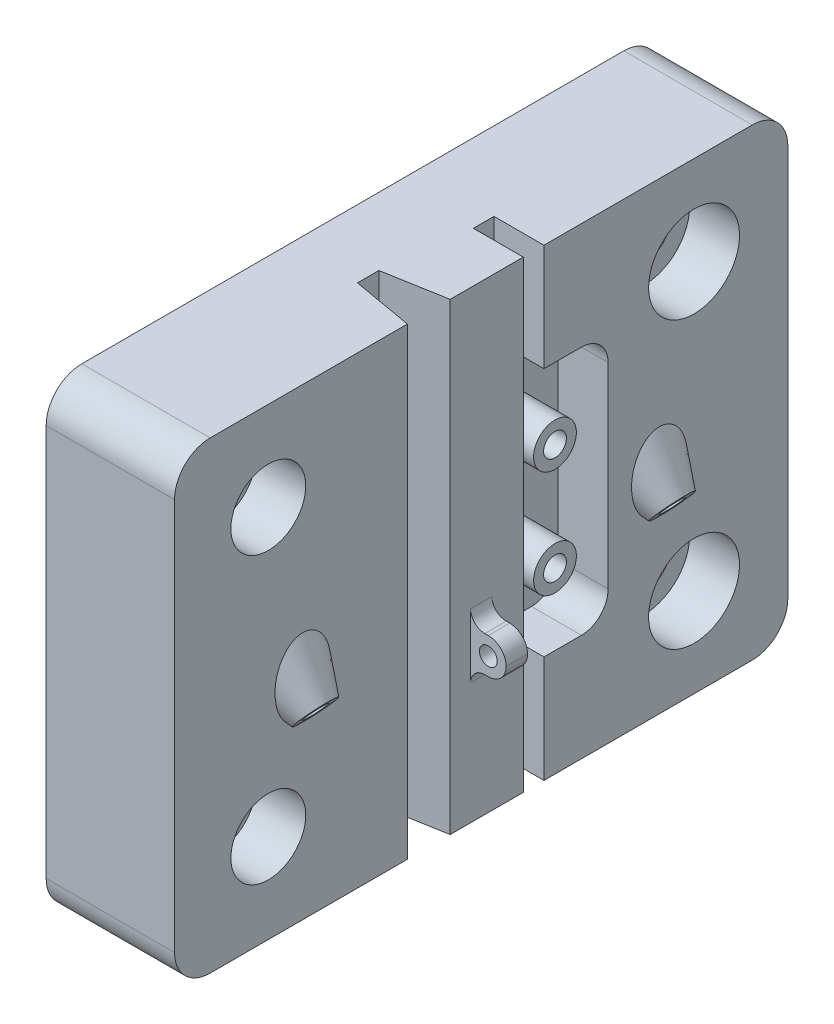
from build123d import *

# Parameters (mm, degrees)
BOSS_EXTRUDE1_DEPTH = 11
CLEAR_HOLE_BOLT_R   = 3.7
CLEAR_HOLE_BOLT_R_2 = 2.6
CUT_EXTRUDE1_DEPTH  = 56.011362463
SKETCH5_R           = 3
SKETCH5_W           = 5
SKETCH5_H           = 15
BOSS_EXTRUDE2_DEPTH = 7
M3_SUPPORT_HOLES_R  = 1.6
CUT_EXTRUDE2_DEPTH  = 57.826490302
CUT_EXTRUDE4_DEPTH  = 3
SKETCH7_R           = 5.25
SKETCH7_R_2         = 6.375
BOSS_EXTRUDE3_DEPTH = 7
CUT_EXTRUDE5_START  = -32.5
CUT_EXTRUDE5_DEPTH  = 65
SKETCH24_R          = 1.6
CUT_EXTRUDE7_DEPTH  = 64.877232071
CUT_EXTRUDE8_START  = -15.5
CUT_EXTRUDE8_DEPTH  = 20
SKETCH26_W          = 3
SKETCH26_H          = 5
BOSS_EXTRUDE7_DEPTH = 5
SKETCH27_R          = 1.25
CUT_EXTRUDE9_DEPTH  = 3
FILLET1_R           = 2.5
FILLET2_R           = 2


# Read off the part's stored shape, not the designer's step: Cut-Extrude5, Boss-Extrude6
with BuildPart() as part:
    # Main Body → Boss-Extrude1 (new body)
    with BuildSketch(Plane(origin=(0, 0, 0), x_dir=(0, 0, -1), z_dir=(1, 0, 0))):
        with BuildLine():
            Line((-38, 32.5), (38, 32.5))
            ThreePointArc((38, 32.5), (41.535533906, 31.035533906), (43, 27.5))
            Line((43, 27.5), (43, -27.5))
            ThreePointArc((43, -27.5), (41.535533906, -31.035533906), (38, -32.5))
            Line((38, -32.5), (-38, -32.5))
            ThreePointArc((-38, -32.5), (-41.535533906, -31.035533906), (-43, -27.5))
            Line((-43, -27.5), (-43, 27.5))
            ThreePointArc((-43, 27.5), (-41.535533906, 31.035533906), (-38, 32.5))
        make_face()
    extrude(amount=BOSS_EXTRUDE1_DEPTH)

    # Clear Hole-Bolt → Cut-Extrude1 (cut, through all)
    with BuildSketch(Plane(origin=(11, 0, 0), x_dir=(0, 0, -1), z_dir=(1, 0, 0))):
        with Locations((29.85, 20)):
            Circle(CLEAR_HOLE_BOLT_R)
        with Locations((-29.85, 20)):
            Circle(CLEAR_HOLE_BOLT_R_2)
        with Locations(Location((-29.85, -20, 0), (0, 0, 180))):
            Circle(CLEAR_HOLE_BOLT_R_2)
        with Locations(Location((29.85, -20, 0), (0, 0, 180))):
            Circle(CLEAR_HOLE_BOLT_R)
    extrude(amount=-CUT_EXTRUDE1_DEPTH, mode=Mode.SUBTRACT)

    # Sketch5 → Boss-Extrude2 (add)
    with BuildSketch(Plane(origin=(11, 0, 0), x_dir=(0, 0, -1), z_dir=(1, 0, 0))):
        with Locations((10.35, -7.5)):
            Circle(SKETCH5_R)
        with Locations(Location((10.35, 7.5, 0), (0, 0, 180))):
            Circle(SKETCH5_R)
        with Locations((11.3, -25)):
            Rectangle(SKETCH5_W, SKETCH5_H)
        with Locations((3.4, -25)):
            Rectangle(SKETCH5_W, SKETCH5_H)
        with Locations((11.3, 25)):
            Rectangle(SKETCH5_W, SKETCH5_H)
        with Locations((3.4, 25)):
            Rectangle(SKETCH5_W, SKETCH5_H)
    extrude(amount=BOSS_EXTRUDE2_DEPTH)

    # M3 Support Holes → Cut-Extrude2 (cut, through all)
    with BuildSketch(Plane(origin=(18, 0, 0), x_dir=(0, 0, -1), z_dir=(1, 0, 0))):
        with Locations((10.35, 7.5)):
            Circle(M3_SUPPORT_HOLES_R)
        with Locations(Location((10.35, -7.5, 0), (0, 0, 180))):
            Circle(M3_SUPPORT_HOLES_R)
    extrude(amount=-CUT_EXTRUDE2_DEPTH, mode=Mode.SUBTRACT)

    # M3 Nut Support → Cut-Extrude4 (cut)
    with BuildSketch(Plane.ZY):
        Polygon((-8.617949192, 10.5), (-12.082050808, 10.5), (-13.814101615, 7.5), (-12.082050808, 4.5), (-8.617949192, 4.5), (-6.885898385, 7.5), align=None)
        Polygon((-6.885898385, -7.5), (-8.617949192, -10.5), (-12.082050808, -10.5), (-13.814101615, -7.5), (-12.082050808, -4.5), (-8.617949192, -4.5), align=None)
    extrude(amount=-CUT_EXTRUDE4_DEPTH, mode=Mode.SUBTRACT)

    # Sketch7 → Boss-Extrude3 (add)
    # profile 1 of 2: a face of its own
    with BuildSketch(Plane(origin=(11, 0, 0), x_dir=(0, 0, -1), z_dir=(1, 0, 0))):
        with BuildLine():
            Line((5.9, 32.5), (5.9, -32.5))
            Line((5.9, -32.5), (-38, -32.5))
            ThreePointArc((-38, -32.5), (-41.535533906, -31.035533906), (-43, -27.5))
            Line((-43, -27.5), (-43, 27.5))
            ThreePointArc((-43, 27.5), (-41.535533906, 31.035533906), (-38, 32.5))
            Line((-38, 32.5), (5.9, 32.5))
        make_face()
        with Locations((-29.85, -20)):
            Circle(SKETCH7_R, mode=Mode.SUBTRACT)
        with Locations(Location((-29.85, 20, 0), (0, 0, 180))):
            Circle(SKETCH7_R, mode=Mode.SUBTRACT)
    # profile 2 of 2: a face of its own
    with BuildSketch(Plane(origin=(11, 0, 0), x_dir=(0, 0, -1), z_dir=(1, 0, 0))):
        with BuildLine():
            Line((13.8, 32.5), (13.8, 17.5))
            Line((13.8, 17.5), (14.05, 17.5))
            ThreePointArc((14.05, 17.5), (16.701650429, 16.401650429), (17.8, 13.75))
            Line((17.8, 13.75), (17.8, -13.75))
            ThreePointArc((17.8, -13.75), (16.701650429, -16.401650429), (14.05, -17.5))
            Line((14.05, -17.5), (13.8, -17.5))
            Line((13.8, -17.5), (13.8, -32.5))
            Line((13.8, -32.5), (38, -32.5))
            ThreePointArc((38, -32.5), (41.535533906, -31.035533906), (43, -27.5))
            Line((43, -27.5), (43, 27.5))
            ThreePointArc((43, 27.5), (41.535533906, 31.035533906), (38, 32.5))
            Line((38, 32.5), (13.8, 32.5))
        make_face()
        with Locations((29.85, -20)):
            Circle(SKETCH7_R_2, mode=Mode.SUBTRACT)
        with Locations(Location((29.85, 20, 0), (0, 0, 180))):
            Circle(SKETCH7_R_2, mode=Mode.SUBTRACT)
    extrude(amount=BOSS_EXTRUDE3_DEPTH)

    # Cut-Extrude5 outline → Cut-Extrude5 (cut)
    with BuildSketch(Plane(origin=(0, 0, 0), x_dir=(1, 0, 0), z_dir=(0, 1, 0)).offset(CUT_EXTRUDE5_START)):
        Polygon((18, -10.348779336), (18, -4.351220664), (9.5, -5.85), (9.5, -8.85), align=None)
    extrude(amount=CUT_EXTRUDE5_DEPTH, mode=Mode.SUBTRACT)

    # Boss-Extrude6 outline → Boss-Extrude6 (revolve)
    with BuildSketch(Plane(origin=(5.019399377, 5.981887241, 25), x_dir=(0.6427876096865357, 0.7660444431189811, 0), z_dir=(0, 0, -1))):
        Polygon((5.590261427, 12.222600941), (2.75, 19.252494658), (0, 19.252494658), (0, 12.222600941), align=None)
    boss_extrude6 = revolve(axis=Axis((5.019399377, 5.981887241, 25), (0.7660444431189813, -0.6427876096865358, 0)))

    # Sketch24 → Cut-Extrude7 (cut, through all)
    with BuildSketch(Plane(origin=(14.748266549, -12.375265022, 0), x_dir=(0, 0, -1), z_dir=(0.7660444431189812, -0.6427876096865357, 0))):
        with Locations(Location((-25, 7.808799208, 0), (0, 0, 90))):
            Circle(SKETCH24_R)
    cut_extrude7 = extrude(amount=-CUT_EXTRUDE7_DEPTH, mode=Mode.SUBTRACT)

    # Sketch25 → Cut-Extrude8 (cut)
    with BuildSketch(Plane(origin=(14.748266549, -12.375265022, 0), x_dir=(0, 0, -1), z_dir=(0.7660444431189812, -0.6427876096865356, 0)).offset(CUT_EXTRUDE8_START)):
        Polygon((-23.267949192, 10.808799208), (-26.732050808, 10.808799208), (-28.464101615, 7.808799208), (-26.732050808, 4.808799208), (-23.267949192, 4.808799208), (-21.535898385, 7.808799208), align=None)
    cut_extrude8 = extrude(amount=-CUT_EXTRUDE8_DEPTH, mode=Mode.SUBTRACT)

    # Mirror2: Boss-Extrude6, Cut-Extrude7, Cut-Extrude8 across plane
    add(boss_extrude6.mirror(Plane.XY))
    add(cut_extrude7.mirror(Plane.XY), mode=Mode.SUBTRACT)
    add(cut_extrude8.mirror(Plane.XY), mode=Mode.SUBTRACT)

    # Sketch26 → Boss-Extrude7 (add)
    with BuildSketch(Plane(origin=(18, 0, 0), x_dir=(0, 0, -1), z_dir=(1, 0, 0))):
        with Locations((0, -11)):
            Rectangle(SKETCH26_W, SKETCH26_H)
    extrude(amount=BOSS_EXTRUDE7_DEPTH)

    # Sketch27 → Cut-Extrude9 (cut)
    with BuildSketch(Plane.XY.offset(1.5)):
        with Locations((20.5, -11)):
            Circle(SKETCH27_R)
    extrude(amount=-CUT_EXTRUDE9_DEPTH, mode=Mode.SUBTRACT)

    # Fillet1
    fillet1_edges = [part.edges().sort_by_distance(p)[0] for p in [
        (23, -13.5, 0),
        (23, -8.5, 0),
    ]]
    fillet(fillet1_edges, radius=FILLET1_R - 0.0001)  # a hair under: the kernel refuses the full size

    # Fillet2
    fillet2_edges = [part.edges().sort_by_distance(p)[0] for p in [
        (18, -8.5, 0),
        (18, -13.5, 0),
    ]]
    fillet(fillet2_edges, radius=FILLET2_R)


solid = part.part
